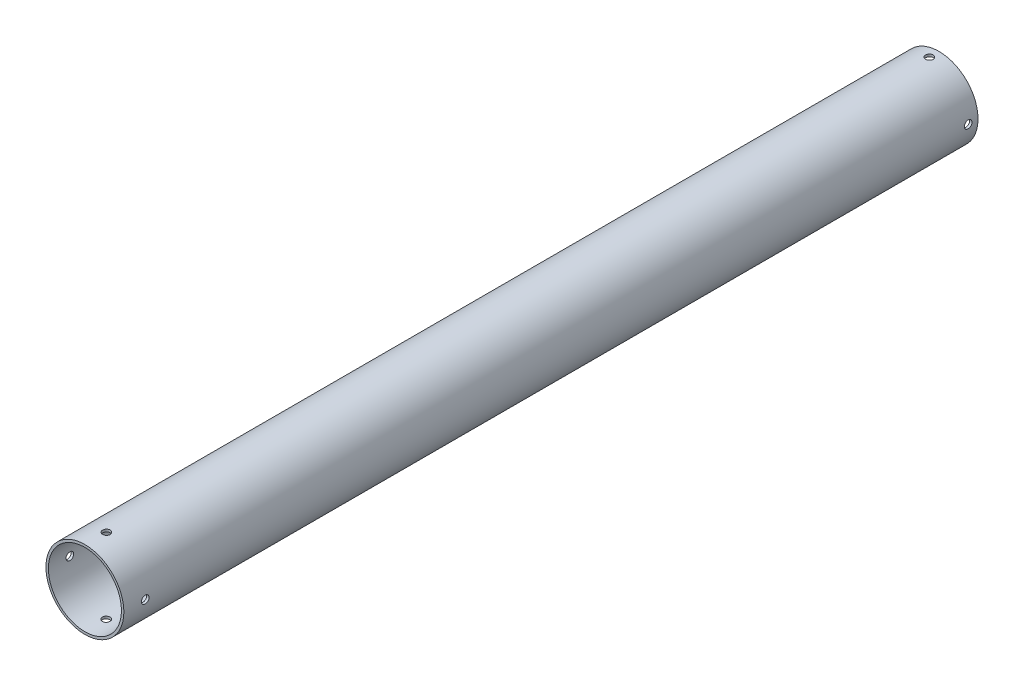
from build123d import *

# Parameters (mm, degrees)
SKETCH1_R               = 25.4
SKETCH1_R_2             = 23.8125
BOSS_EXTRUDE1_DEPTH     = 278.342506179
CUT_EXTRUDE1_DEPTH      = 281.650798584
CUT_EXTRUDE1_DEPTH_BACK = 281.650798584
SKETCH2_R               = 2.4892
CUT_EXTRUDE2_DEPTH      = 281.650798702
CUT_EXTRUDE2_DEPTH_BACK = 281.650798702
SKETCH3_R               = 2.4892
CUT_EXTRUDE3_DEPTH      = 281.650798702
CUT_EXTRUDE3_DEPTH_BACK = 281.650798702
SKETCH4_R               = 2.4892
CUT_EXTRUDE4_DEPTH      = 281.650798702
CUT_EXTRUDE4_DEPTH_BACK = 281.650798702
SKETCH5_R               = 2.4892


with BuildPart() as part:
    # Sketch1 → Boss-Extrude1 (new, symmetric)
    with BuildSketch(Plane.XY):
        Circle(SKETCH1_R)
        Circle(SKETCH1_R_2, mode=Mode.SUBTRACT)
    extrude(amount=BOSS_EXTRUDE1_DEPTH, both=True)

    # Sketch2 → Cut-Extrude1 (cut, two sides: drawn at the far end of the back side and taken through both)
    with BuildSketch(Plane(origin=(0, 0, 0), x_dir=(0, 0, -1), z_dir=(1, 0, 0)).offset(-CUT_EXTRUDE1_DEPTH_BACK)):
        with Locations((271.992506179, 0)):
            Circle(SKETCH2_R)
    extrude(amount=CUT_EXTRUDE1_DEPTH + CUT_EXTRUDE1_DEPTH_BACK, mode=Mode.SUBTRACT)

    # Sketch3 → Cut-Extrude2 (cut, two sides: drawn at the far end of the back side and taken through both)
    with BuildSketch(Plane(origin=(0, 0, 0), x_dir=(1, 0, 0), z_dir=(0, 1, 0)).offset(-CUT_EXTRUDE2_DEPTH_BACK)):
        with Locations((0, 271.992506179)):
            Circle(SKETCH3_R)
    extrude(amount=CUT_EXTRUDE2_DEPTH + CUT_EXTRUDE2_DEPTH_BACK, mode=Mode.SUBTRACT)

    # Sketch4 → Cut-Extrude3 (cut, two sides: drawn at the far end of the back side and taken through both)
    with BuildSketch(Plane(origin=(0, 0, 0), x_dir=(0, 0, -1), z_dir=(1, 0, 0)).offset(-CUT_EXTRUDE3_DEPTH_BACK)):
        with Locations((-264.372506179, 0)):
            Circle(SKETCH4_R)
    extrude(amount=CUT_EXTRUDE3_DEPTH + CUT_EXTRUDE3_DEPTH_BACK, mode=Mode.SUBTRACT)

    # Sketch5 → Cut-Extrude4 (cut, two sides: drawn at the far end of the back side and taken through both)
    with BuildSketch(Plane(origin=(0, 0, 0), x_dir=(1, 0, 0), z_dir=(0, 1, 0)).offset(-CUT_EXTRUDE4_DEPTH_BACK)):
        with Locations((0, -264.372506179)):
            Circle(SKETCH5_R)
    extrude(amount=CUT_EXTRUDE4_DEPTH + CUT_EXTRUDE4_DEPTH_BACK, mode=Mode.SUBTRACT)


solid = part.part
